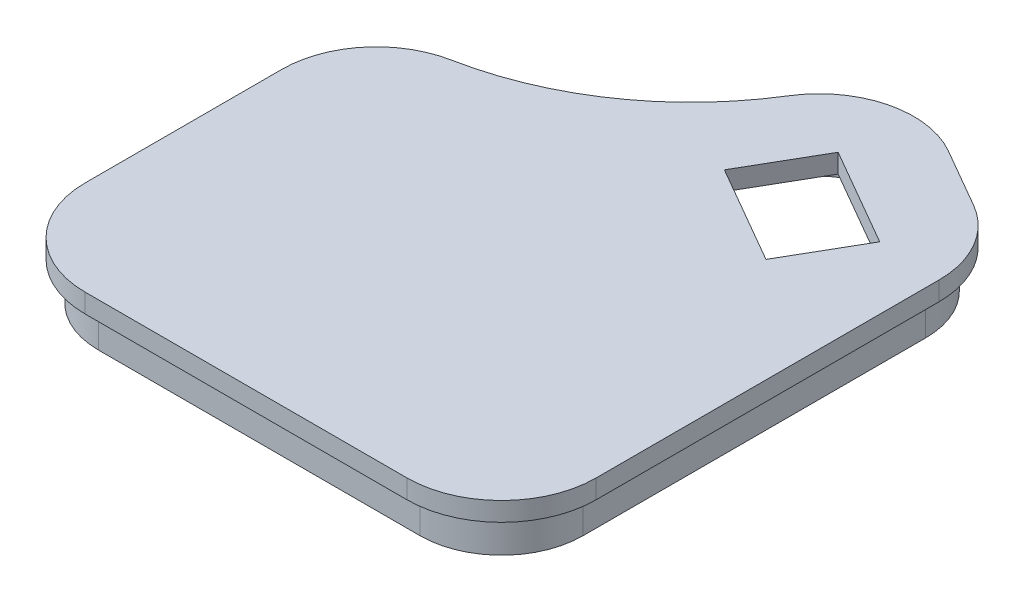
from build123d import *

# Parameters (mm, degrees)
SKETCH1_W               = 260
SKETCH1_H               = 100
BOSS_EXTRUDE1_DEPTH     = 3
CUT_EXTRUDE1_DEPTH      = 5
SKETCH5_W               = 260
SKETCH5_H               = 80
BOSS_EXTRUDE4_DEPTH     = 3
BOSS_EXTRUDE5_START     = 70
BOSS_EXTRUDE5_DEPTH     = 70
BOSS_EXTRUDE6_DEPTH     = 70
CUT_EXTRUDE3_DEPTH      = 198.810515393
SKETCH10_R              = 5
SKETCH10_R_2            = 1.75
BOSS_EXTRUDE7_DEPTH     = 50
CHAMFER1_SIZE           = 5
CHAMFER1_SIZE2          = 8.660254038
FILLET1_R               = 22
FILLET2_R               = 25
CUT_EXTRUDE4_START      = 20
CUT_EXTRUDE4_DEPTH      = 20
SKETCH12_R              = 1.75
CUT_EXTRUDE5_DEPTH      = 20
CUT_EXTRUDE6_DEPTH      = 40
FILLET3_R               = 5
BOSS_EXTRUDE8_DEPTH     = 10
CUT_EXTRUDE7_DEPTH      = 202.715145688
CUT_EXTRUDE7_DEPTH_BACK = 202.715145688
SKETCH16_W              = 135
SKETCH16_H              = 73
BOSS_EXTRUDE9_DEPTH     = 5
CUT_EXTRUDE8_DEPTH      = 5


with BuildPart() as part:
    # Sketch1 → Boss-Extrude1 (new body)
    with BuildSketch(Plane(origin=(0, 0, 0), x_dir=(1, 0, 0), z_dir=(0, 1, 0))):
        Rectangle(SKETCH1_W, SKETCH1_H)
    extrude(amount=BOSS_EXTRUDE1_DEPTH)

    # Sketch4 → Cut-Extrude1 (cut)
    with BuildSketch(Plane(origin=(0, 3, 0), x_dir=(1, 0, 0), z_dir=(0, 1, 0))):
        with BuildLine():
            Line((-77.534249575, 30.291115131), (-130, 0))
            Line((-130, 0), (-130, 50))
            Line((-130, 50), (130, 50))
            Line((130, 50), (130, 0))
            Line((130, 0), (77.534249575, 30.291115131))
            ThreePointArc((77.534249575, 30.291115131), (0, -30), (-77.534249575, 30.291115131))
        make_face()
    extrude(amount=-CUT_EXTRUDE1_DEPTH, mode=Mode.SUBTRACT)

    # Sketch5 → Boss-Extrude4 (add)
    with BuildSketch(Plane(origin=(0, 3, 0), x_dir=(1, 0, 0), z_dir=(0, 1, 0))):
        with Locations((0, -90)):
            Rectangle(SKETCH5_W, SKETCH5_H)
    extrude(amount=-BOSS_EXTRUDE4_DEPTH)

    # Sketch6 → Boss-Extrude5 (add)
    with BuildSketch(Plane(origin=(0, 3, 0), x_dir=(1, 0, 0), z_dir=(0, 1, 0)).offset(BOSS_EXTRUDE5_START)):
        with BuildLine():
            Line((-77.534249575, 30.291115131), (-130, 0))
            Line((-130, 0), (-130, -130))
            Line((-130, -130), (130, -130))
            Line((130, -130), (130, 0))
            Line((130, 0), (77.534249575, 30.291115131))
            ThreePointArc((77.534249575, 30.291115131), (0, -30), (-77.534249575, 30.291115131))
        make_face()
        with BuildLine():
            Line((-79.381629809, 25.76042804), (-127, -1.732050808))
            Line((-127, -1.732050808), (-127, -127))
            Line((-127, -127), (127, -127))
            Line((127, -127), (127, -1.732050808))
            Line((127, -1.732050808), (79.381629809, 25.76042804))
            ThreePointArc((79.381629809, 25.76042804), (0, -33), (-79.381629809, 25.76042804))
        make_face(mode=Mode.SUBTRACT)
    extrude(amount=-BOSS_EXTRUDE5_DEPTH)

    # Sketch7 → Boss-Extrude6 (add)
    with BuildSketch(Plane(origin=(0, 73, 0), x_dir=(1, 0, 0), z_dir=(0, 1, 0))):
        with BuildLine():
            Line((-5, -32.849260709), (-5, -130))
            Line((-5, -130), (-2, -130))
            Line((-2, -130), (-2, -32.975900116))
            ThreePointArc((-2, -32.975900116), (-3.500572722, -32.92614781), (-5, -32.849260709))
        make_face()
    extrude(amount=-BOSS_EXTRUDE6_DEPTH)

    # Sketch9 → Cut-Extrude3 (cut, through all)
    with BuildSketch(Plane(origin=(0, 73, 0), x_dir=(1, 0, 0), z_dir=(0, 1, 0))):
        Polygon((-5, -32.849260709), (-5, -144.876678539), (-379.728059333, -144.876678539), (-379.728059333, 52.069032857), (-5, 52.069032857), align=None)
    extrude(amount=-CUT_EXTRUDE3_DEPTH, mode=Mode.SUBTRACT)

    # Sketch10 → Boss-Extrude7 (add)
    # profile 1 of 4: a face of its own
    with BuildSketch(Plane(origin=(0, 3, 0), x_dir=(1, 0, 0), z_dir=(0, 1, 0))):
        with Locations(Location((14, -46.75, 0), (0, 0, 90))):
            Circle(SKETCH10_R)
        with Locations(Location((14, -46.75, 0), (0, 0, 270))):
            Circle(SKETCH10_R_2, mode=Mode.SUBTRACT)
    # profile 2 of 4: a face of its own
    with BuildSketch(Plane(origin=(0, 3, 0), x_dir=(1, 0, 0), z_dir=(0, 1, 0))):
        with Locations(Location((86, -46.75, 0), (0, 0, 90))):
            Circle(SKETCH10_R)
        with Locations(Location((86, -46.75, 0), (0, 0, 270))):
            Circle(SKETCH10_R_2, mode=Mode.SUBTRACT)
    # profile 3 of 4: a face of its own
    with BuildSketch(Plane(origin=(0, 3, 0), x_dir=(1, 0, 0), z_dir=(0, 1, 0))):
        with Locations(Location((86, -113.25, 0), (0, 0, 90))):
            Circle(SKETCH10_R)
        with Locations(Location((86, -113.25, 0), (0, 0, 270))):
            Circle(SKETCH10_R_2, mode=Mode.SUBTRACT)
    # profile 4 of 4: a face of its own
    with BuildSketch(Plane(origin=(0, 3, 0), x_dir=(1, 0, 0), z_dir=(0, 1, 0))):
        with Locations(Location((14, -113.25, 0), (0, 0, 90))):
            Circle(SKETCH10_R)
        with Locations(Location((14, -113.25, 0), (0, 0, 270))):
            Circle(SKETCH10_R_2, mode=Mode.SUBTRACT)
    extrude(amount=BOSS_EXTRUDE7_DEPTH)

    # Chamfer1
    chamfer1_edges = [part.edges().sort_by_distance(p)[0] for p in [
        (86, 3, 51.75),
        (14, 3, 51.75),
        (86, 3, 118.25),
        (14, 3, 118.25),
    ]]
    chamfer1_side = [part.faces().sort_by_distance(p)[0] for p in [
        (68.049806081, 3, 64.998636776),
    ]]
    chamfer(chamfer1_edges, length=CHAMFER1_SIZE, length2=CHAMFER1_SIZE2, reference=chamfer1_side[0])

    # Fillet1
    fillet1_edges = [part.edges().sort_by_distance(p)[0] for p in [
        (-2, 38, 127),
        (-2, 38, 32.975900116),
        (127, 38, 127),
        (127, 38, 1.732050808),
        (79.381629809, 38, -25.76042804),
    ]]
    fillet(fillet1_edges, radius=FILLET1_R)

    # Fillet2
    fillet2_edges = [part.edges().sort_by_distance(p)[0] for p in [
        (-5, 36.5, 29.843597113),
        (-5, 36.5, 130),
        (77.534249575, 36.5, -30.291115131),
        (130, 36.5, 0),
        (130, 36.5, 130),
    ]]
    fillet(fillet2_edges, radius=FILLET2_R)

    # Sketch11 → Cut-Extrude4 (cut)
    with BuildSketch(Plane(origin=(0, 3, 0), x_dir=(1, 0, 0), z_dir=(0, 1, 0)).offset(CUT_EXTRUDE4_START)):
        with BuildLine():
            Line((52.464250206, -10.394556462), (54.431659589, -12.65935233))
            ThreePointArc((54.431659589, -12.65935233), (36.359512028, -24.612236832), (15.80952381, -31.480420697))
            Line((15.80952381, -31.480420697), (15.238095238, -28.53534525))
            ThreePointArc((15.238095238, -28.53534525), (35.045312798, -21.915408995), (52.464250206, -10.394556462))
        make_face()
        Polygon((101.737077009, 16.317606197), (100.237077009, 13.719529986), (116, 4.618802154), (117.5, 7.216878365), align=None)
    extrude(amount=-CUT_EXTRUDE4_DEPTH, mode=Mode.SUBTRACT)

    # Sketch12 → Cut-Extrude5 (cut)
    with BuildSketch(Plane(origin=(0, 3, 0), x_dir=(1, 0, 0), z_dir=(0, 1, 0))):
        with Locations(Location((89.237077009, -5.333028897, 0), (0, 0, 270))):
            Circle(SKETCH12_R)
        with Locations(Location((105, -105, 0), (0, 0, 270))):
            Circle(SKETCH12_R)
        with Locations(Location((15, -105, 0), (0, 0, 66.494954424))):
            Circle(SKETCH12_R)
        with Locations(Location((15, -55, 0), (0, 0, 260.317408662))):
            Circle(SKETCH12_R)
    extrude(amount=-CUT_EXTRUDE5_DEPTH, mode=Mode.SUBTRACT)

    # Sketch14 → Cut-Extrude6 (cut)
    with BuildSketch(Plane.XZ.offset(-23)):
        Polygon((101.737077009, -16.317606197), (117.5, -7.216878365), (116, -4.618802154), (100.237077009, -13.719529986), align=None)
    extrude(amount=-CUT_EXTRUDE6_DEPTH, mode=Mode.SUBTRACT)

    # Fillet3
    # the kernel refuses this fillet: 5 mm, written as the material it adds along each edge
    with BuildSketch(Plane(origin=(101.737077009, 3, -16.317606197), x_dir=(0.8660254037844373, 0, 0.5000000000000024), z_dir=(-0.5000000000000026, 0, 0.8660254037844373))) as fillet3_piece_1_section:
        with BuildLine():
            CenterArc((FILLET3_R, FILLET3_R), FILLET3_R, 180, 90)
            Line((0, FILLET3_R), (0, 0))
            Line((0, 0), (FILLET3_R, 0))
        make_face()
    fillet3_piece_1 = extrude(amount=15.5, mode=Mode.PRIVATE)
    fillet3_piece_1 = fillet3_piece_1 - Plane(origin=(89.237077009, 3.433810283, 5.333028897), x_dir=(-0.8498769238912803, 0, -0.5269812275945843), z_dir=(0, -1, 0)) * Cylinder(22, 52, mode=Mode.PRIVATE)
    add(fillet3_piece_1)
    with BuildSketch(Plane(origin=(109.75, 3, 6.206515394), x_dir=(-0.8660254037844346, 0, -0.500000000000007), z_dir=(0.500000000000007, 0, -0.8660254037844346))) as fillet3_piece_2_section:
        with BuildLine():
            CenterArc((FILLET3_R, FILLET3_R), FILLET3_R, 180, 90)
            Line((0, FILLET3_R), (0, 0))
            Line((0, 0), (FILLET3_R, 0))
        make_face()
    fillet3_piece_2 = extrude(amount=15.5, mode=Mode.PRIVATE)
    fillet3_piece_2 = fillet3_piece_2 - Plane(origin=(105, 4.115508028, 14.43375673), x_dir=(0.5000000000000037, 0, -0.8660254037844366), z_dir=(0, -1, 0)) * Cylinder(22, 51, mode=Mode.PRIVATE)
    add(fillet3_piece_2)
    with BuildSketch(Plane(origin=(44.266711112, 3, 0.957907015), x_dir=(-0.754931955778907, 0, 0.6558031275800951), z_dir=(0.6558031275800951, 0, 0.754931955778907))) as fillet3_piece_3_section:
        with BuildLine():
            CenterArc((FILLET3_R, -FILLET3_R), FILLET3_R, 90, 90)
            Line((0, -FILLET3_R), (0, 0))
            Line((0, 0), (FILLET3_R, 0))
        make_face()
    fillet3_piece_3 = extrude(amount=28, mode=Mode.PRIVATE)
    fillet3_piece_3 = fillet3_piece_3 & Plane(origin=(0, 4.116736713, -50), x_dir=(0.9564051784275456, 0, 0.2920430356590872), z_dir=(0, 1, 0)) * Cylinder(83, 77, mode=Mode.PRIVATE)
    fillet3_piece_3 = fillet3_piece_3 - Plane(origin=(0, 4.116736713, -50), x_dir=(0.9691781196921706, 0, 0.2463610608638238), z_dir=(0, 1, 0)) * Cylinder(80, 77, mode=Mode.PRIVATE)
    add(fillet3_piece_3)
    with BuildSketch(Plane(origin=(18.19047619, 3, 43.751568392), x_dir=(0.9816918156232519, 0, -0.19047619047619338), z_dir=(-0.19047619047619338, 0, -0.981691815623252))) as fillet3_piece_4_section:
        with BuildLine():
            CenterArc((FILLET3_R, -FILLET3_R), FILLET3_R, 90, 90)
            Line((0, -FILLET3_R), (0, 0))
            Line((0, 0), (FILLET3_R, 0))
        make_face()
    fillet3_piece_4 = extrude(amount=28, mode=Mode.PRIVATE)
    fillet3_piece_4 = fillet3_piece_4 - Plane(origin=(20, 4.115502573, 53.07764064), x_dir=(-0.19047619047619013, 0, -0.9816918156232526), z_dir=(0, -1, 0)) * Cylinder(22, 77, mode=Mode.PRIVATE)
    fillet3_piece_4 = fillet3_piece_4 - Plane(origin=(0, 4.115502573, -50), x_dir=(0.9691781196921706, 0, 0.2463610608638238), z_dir=(0, 1, 0)) * Cylinder(80, 77, mode=Mode.PRIVATE)
    add(fillet3_piece_4)
    with BuildSketch(Plane(origin=(44.266711112, 23, 0.957907015), x_dir=(-0.754931955778907, 0, 0.6558031275800951), z_dir=(0.6558031275800951, 0, 0.754931955778907))) as fillet3_piece_5_section:
        with BuildLine():
            CenterArc((FILLET3_R, FILLET3_R), FILLET3_R, 180, 90)
            Line((0, FILLET3_R), (0, 0))
            Line((0, 0), (FILLET3_R, 0))
        make_face()
    fillet3_piece_5 = extrude(amount=28, mode=Mode.PRIVATE)
    fillet3_piece_5 = fillet3_piece_5 & Plane(origin=(0, 21.883263287, -50), x_dir=(0.9564051784275456, 0, 0.2920430356590872), z_dir=(0, 1, 0)) * Cylinder(83, 77, mode=Mode.PRIVATE)
    fillet3_piece_5 = fillet3_piece_5 - Plane(origin=(0, 21.883263287, -50), x_dir=(0.9691781196921706, 0, 0.2463610608638238), z_dir=(0, 1, 0)) * Cylinder(80, 77, mode=Mode.PRIVATE)
    add(fillet3_piece_5)
    with BuildSketch(Plane(origin=(18.19047619, 23, 43.751568392), x_dir=(0, -1, 0), z_dir=(-0.19047619047619338, 0, -0.981691815623252))) as fillet3_piece_6_section:
        with BuildLine():
            CenterArc((FILLET3_R, -FILLET3_R), FILLET3_R, 90, 90)
            Line((0, -FILLET3_R), (0, 0))
            Line((0, 0), (FILLET3_R, 0))
        make_face()
    fillet3_piece_6 = extrude(amount=28, mode=Mode.PRIVATE)
    fillet3_piece_6 = fillet3_piece_6 & Plane(origin=(0, 21.870297326, -50), x_dir=(0.9564051784275456, 0, 0.2920430356590872), z_dir=(0, 1, 0)) * Cylinder(83, 77, mode=Mode.PRIVATE)
    fillet3_piece_6 = fillet3_piece_6 - Plane(origin=(0, 21.870297326, -50), x_dir=(0.9691781196921706, 0, 0.2463610608638238), z_dir=(0, 1, 0)) * Cylinder(80, 77, mode=Mode.PRIVATE)
    add(fillet3_piece_6)
    with BuildSketch(Plane(origin=(100.237077009, 63, -13.719529986), x_dir=(0.866025403784437, 0, 0.5000000000000028), z_dir=(0.5000000000000028, 0, -0.866025403784437))) as fillet3_piece_7:
        with BuildLine():
            CenterArc((FILLET3_R, FILLET3_R), FILLET3_R, 180, 90)
            Line((0, FILLET3_R), (0, 0))
            Line((0, 0), (FILLET3_R, 0))
        make_face()
    extrude(amount=3)
    with BuildSketch(Plane(origin=(117.5, 63, -7.216878365), x_dir=(0, -1, 0), z_dir=(-0.500000000000007, 0, 0.8660254037844346))) as fillet3_piece_8:
        with BuildLine():
            CenterArc((FILLET3_R, -FILLET3_R), FILLET3_R, 90, 90)
            Line((0, -FILLET3_R), (0, 0))
            Line((0, 0), (FILLET3_R, 0))
        make_face()
    extrude(amount=3)

    # Sketch16 → Cut-Extrude7 (cut, two sides: drawn at the far end of the back side and taken through both)
    with BuildSketch(Plane.XY.offset(-CUT_EXTRUDE7_DEPTH_BACK)):
        with Locations((62.5, 36.5)):
            Rectangle(SKETCH16_W, SKETCH16_H)
    extrude(amount=CUT_EXTRUDE7_DEPTH + CUT_EXTRUDE7_DEPTH_BACK, mode=Mode.SUBTRACT)


with BuildPart() as body_2:
    # Sketch15 → Boss-Extrude8 (new body)
    with BuildSketch(Plane(origin=(0, 73, 0), x_dir=(1, 0, 0), z_dir=(0, 1, 0))):
        with BuildLine():
            Line((126.5, -105), (126.5, -14.43375673))
            ThreePointArc((126.5, -14.43375673), (123.619546181, -3.68375673), (115.75, 4.185789452))
            Line((115.75, 4.185789452), (99.987077009, 13.286517284))
            ThreePointArc((99.987077009, 13.286517284), (83.999666249, 15.519297796), (70.964723145, 5.997067496))
            ThreePointArc((70.964723145, 5.997067496), (47.402272696, -18.740632403), (15.904761905, -31.971266605))
            ThreePointArc((15.904761905, -31.971266605), (3.412389879, -39.399146919), (-1.5, -53.07764064))
            Line((-1.5, -53.07764064), (-1.5, -105))
            ThreePointArc((-1.5, -105), (4.797204204, -120.202795796), (20, -126.5))
            Line((20, -126.5), (105, -126.5))
            ThreePointArc((105, -126.5), (120.202795796, -120.202795796), (126.5, -105))
        make_face()
        with BuildLine():
            Line((124.5, -105), (124.5, -14.43375673))
            ThreePointArc((124.5, -14.43375673), (121.887495374, -4.68375673), (114.75, 2.453738644))
            Line((114.75, 2.453738644), (98.987077009, 11.554466476))
            ThreePointArc((98.987077009, 11.554466476), (84.48686725, 13.579546476), (72.664476993, 4.943105041))
            ThreePointArc((72.664476993, 4.943105041), (48.537656474, -20.387114617), (16.285714286, -33.934650236))
            ThreePointArc((16.285714286, -33.934650236), (4.955423379, -40.67156494), (0.5, -53.07764064))
            Line((0.5, -53.07764064), (0.5, -105))
            ThreePointArc((0.5, -105), (6.211417767, -118.788582233), (20, -124.5))
            Line((20, -124.5), (105, -124.5))
            ThreePointArc((105, -124.5), (118.788582233, -118.788582233), (124.5, -105))
        make_face(mode=Mode.SUBTRACT)
    extrude(amount=BOSS_EXTRUDE8_DEPTH)

    # Sketch17 → Boss-Extrude9 (add)
    with BuildSketch(Plane(origin=(0, 83, 0), x_dir=(1, 0, 0), z_dir=(0, 1, 0))):
        with BuildLine():
            Line((130, -105), (130, -14.43375673))
            ThreePointArc((130, -14.43375673), (126.650635095, -1.93375673), (117.5, 7.216878365))
            Line((117.5, 7.216878365), (101.737077009, 16.317606197))
            ThreePointArc((101.737077009, 16.317606197), (83.147064497, 18.913862607), (67.990153911, 7.841501792))
            ThreePointArc((67.990153911, 7.841501792), (45.415351086, -15.85928853), (15.238095238, -28.53534525))
            ThreePointArc((15.238095238, -28.53534525), (0.712081255, -37.172415383), (-5, -53.07764064))
            Line((-5, -53.07764064), (-5, -105))
            ThreePointArc((-5, -105), (2.32233047, -122.67766953), (20, -130))
            Line((20, -130), (105, -130))
            ThreePointArc((105, -130), (122.67766953, -122.67766953), (130, -105))
        make_face()
    extrude(amount=BOSS_EXTRUDE9_DEPTH)

    # Sketch18 → Cut-Extrude8 (cut)
    with BuildSketch(Plane(origin=(0, 88, 0), x_dir=(1, 0, 0), z_dir=(0, 1, 0))):
        Polygon((87.451905284, 1.47114317), (113.432667397, -13.52885683), (102.432667397, -32.581415713), (76.451905284, -17.581415713), align=None)
    extrude(amount=-CUT_EXTRUDE8_DEPTH, mode=Mode.SUBTRACT)


solid = body_2.part
